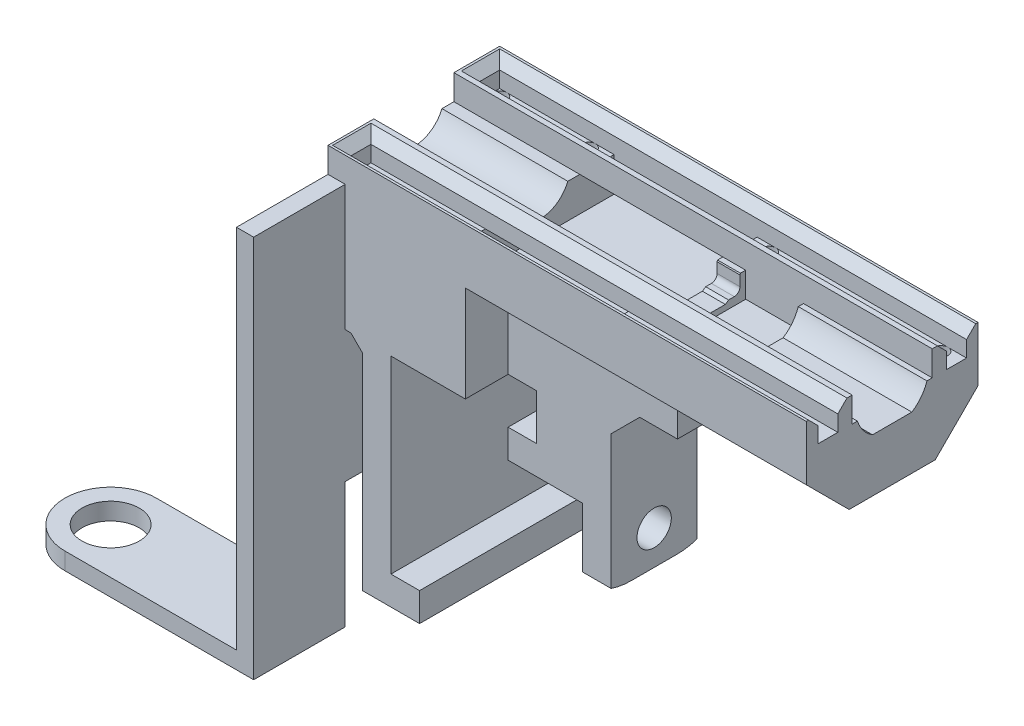
from build123d import *

# Parameters (mm, degrees)
BOSS_EXTRUDE1_DEPTH  = 30
BOSS_EXTRUDE2_DEPTH  = 5
BOSS_EXTRUDE3_START  = -20
BOSS_EXTRUDE3_DEPTH  = 5
BOSS_EXTRUDE4_START  = -8
BOSS_EXTRUDE4_DEPTH  = 5
BOSS_EXTRUDE6_DEPTH  = 16
BOSS_EXTRUDE5_START  = -30
BOSS_EXTRUDE5_DEPTH  = 5
SKETCH11_R           = 3
CUT_EXTRUDE4_DEPTH   = 5
SKETCH12_R           = 1.25
CUT_EXTRUDE5_DEPTH   = 12
SKETCH3_R            = 5.3
CUT_EXTRUDE2_DEPTH   = 22
SKETCH8_R            = 5
CUT_EXTRUDE3_DEPTH   = 3
BOSS_EXTRUDE7_DEPTH  = 13.1
BOSS_EXTRUDE8_START  = 13.1
BOSS_EXTRUDE8_DEPTH  = 23.5
CUT_EXTRUDE6_DEPTH   = 30
SKETCH15_R           = 1.25
CUT_EXTRUDE7_DEPTH   = 30
SKETCH16_W           = 10.1
SKETCH16_H           = 14
CUT_EXTRUDE8_DEPTH   = 4.4
BOSS_EXTRUDE9_START  = -83.6
SKETCH17_W           = 2.5
SKETCH17_H           = 4.4
BOSS_EXTRUDE9_DEPTH  = 83.6
BOSS_EXTRUDE10_START = -53.6
SKETCH18_W           = 2
SKETCH18_H           = 10.4
BOSS_EXTRUDE10_DEPTH = 53.6
SKETCH19_W           = 2
SKETCH19_H           = 4.4
BOSS_EXTRUDE11_DEPTH = 30
BOSS_EXTRUDE12_REACH = 88.105
SKETCH20_W           = 2
SKETCH20_H           = 4.4
BOSS_EXTRUDE13_START = -30
SKETCH20_2_W         = 2
SKETCH20_2_H         = 4.4
BOSS_EXTRUDE13_DEPTH = 5.5
CHAMFER1_SIZE        = 1.6
CUT_EXTRUDE9_REACH   = 113.944


# Read off the part's stored shape, not the designer's step: Boss-Extrude8
with BuildPart() as part:
    # Sketch1 → Boss-Extrude1 (new body)
    with BuildSketch(Plane.XY):
        Polygon((-13, -38), (-23, -38), (-23, -2), (-25, 0), (-26, 0), (-26, -23), (-29, -23), (-29, 22), (-7, 22), (-7, 16), (18, 16), (18, 5), (13, 0), (13, -45), (8, -45), (8, -13), (-5, -13), (-5, -8), (0, -8), (0, 0), (-18, 0), (-18, -33), (-13, -33), align=None)
    extrude(amount=BOSS_EXTRUDE1_DEPTH)

    # Sketch5 → Boss-Extrude2 (add)
    with BuildSketch(Plane.XZ.offset(23)):
        Polygon((-29, 0), (-33.2, 0), (-33.2, 1.7), (-32, 1.7), (-32, 1.2), (-29, 1.2), align=None)
        Polygon((-29, 14.280071998), (-29, 13.080071998), (-33.2, 13.080071998), (-33.2, 14.780071998), (-32, 14.780071998), (-32, 14.280071998), align=None)
        Polygon((-29, 27.360143997), (-29, 26.160143997), (-33.2, 26.160143997), (-33.2, 27.860143997), (-32, 27.860143997), (-32, 27.360143997), align=None)
    extrude(amount=-BOSS_EXTRUDE2_DEPTH)

    # Sketch5<2> → Boss-Extrude3 (add)
    with BuildSketch(Plane.XZ.offset(23).offset(BOSS_EXTRUDE3_START)):
        Polygon((-29, 0), (-33.2, 0), (-33.2, 1.7), (-32, 1.7), (-32, 1.2), (-29, 1.2), align=None)
        Polygon((-29, 14.280071998), (-29, 13.080071998), (-33.2, 13.080071998), (-33.2, 14.780071998), (-32, 14.780071998), (-32, 14.280071998), align=None)
        Polygon((-29, 27.360143997), (-29, 26.160143997), (-33.2, 26.160143997), (-33.2, 27.860143997), (-32, 27.860143997), (-32, 27.360143997), align=None)
    extrude(amount=BOSS_EXTRUDE3_DEPTH)

    # Sketch6 → Boss-Extrude4 (add)
    with BuildSketch(Plane.XZ.offset(23).offset(BOSS_EXTRUDE4_START)):
        Polygon((-29, 3.2), (-29, 4.4), (-33.2, 4.4), (-33.2, 2.7), (-32, 2.7), (-32, 3.2), align=None)
        Polygon((-32, 15.997955345), (-29, 15.997955345), (-29, 17.197955345), (-33.2, 17.197955345), (-33.2, 15.497955345), (-32, 15.497955345), align=None)
        Polygon((-32, 28.795910691), (-29, 28.795910691), (-29, 29.995910691), (-33.2, 29.995910691), (-33.2, 28.295910691), (-32, 28.295910691), align=None)
    extrude(amount=-BOSS_EXTRUDE4_DEPTH)

    # Sketch7 → Boss-Extrude6 (add)
    with BuildSketch(Plane.XY.offset(30)):
        Polygon((-67, -42), (-29, -42), (-29, 22), (-26, 22), (-26, -45), (-67, -45), align=None)
    extrude(amount=BOSS_EXTRUDE6_DEPTH)

    # Sketch6<2> → Boss-Extrude5 (add)
    with BuildSketch(Plane.XZ.offset(23).offset(BOSS_EXTRUDE5_START)):
        Polygon((-29, 3.2), (-29, 4.4), (-33.2, 4.4), (-33.2, 2.7), (-32, 2.7), (-32, 3.2), align=None)
        Polygon((-32, 15.997955345), (-29, 15.997955345), (-29, 17.197955345), (-33.2, 17.197955345), (-33.2, 15.497955345), (-32, 15.497955345), align=None)
        Polygon((-32, 28.795910691), (-29, 28.795910691), (-29, 29.995910691), (-33.2, 29.995910691), (-33.2, 28.295910691), (-32, 28.295910691), align=None)
    extrude(amount=BOSS_EXTRUDE5_DEPTH)

    # Sketch11 → Cut-Extrude4 (cut)
    with BuildSketch(Plane.ZY.offset(-8)):
        with Locations((15, -18)):
            Circle(SKETCH11_R)
        with BuildLine():
            ThreePointArc((11, -24), (3.221825407, -20.778174593), (0, -13))
            Line((0, -13), (0, -45))
            Line((0, -45), (30, -45))
            Line((30, -45), (30, -13))
            ThreePointArc((30, -13), (26.778174593, -20.778174593), (19, -24))
            Line((19, -24), (11, -24))
        make_face()
    extrude(amount=-CUT_EXTRUDE4_DEPTH, mode=Mode.SUBTRACT)

    # Sketch12 → Cut-Extrude5 (cut)
    with BuildSketch(Plane(origin=(0, 22, 0), x_dir=(1, 0, 0), z_dir=(0, 1, 0))):
        with Locations(Location((-10.25, -3.25, 0), (0, 0, 270))):
            Circle(SKETCH12_R)
        with Locations(Location((-10.25, -26.75, 0), (0, 0, 270))):
            Circle(SKETCH12_R)
        with Locations(Location((-25.75, -3.25, 0), (0, 0, 270))):
            Circle(SKETCH12_R)
        with Locations(Location((-25.75, -26.75, 0), (0, 0, 270))):
            Circle(SKETCH12_R)
    extrude(amount=-CUT_EXTRUDE5_DEPTH, mode=Mode.SUBTRACT)

    # Sketch3 → Cut-Extrude2 (cut)
    with BuildSketch(Plane(origin=(-7, 0, 0), x_dir=(0, 0, -1), z_dir=(1, 0, 0))):
        with Locations((-15, 24)):
            Circle(SKETCH3_R)
    extrude(amount=-CUT_EXTRUDE2_DEPTH, mode=Mode.SUBTRACT)

    # Sketch8 → Cut-Extrude3 (cut)
    with BuildSketch(Plane(origin=(0, -42, 0), x_dir=(1, 0, 0), z_dir=(0, 1, 0))):
        with BuildLine():
            ThreePointArc((-59, -46), (-64.656854249, -43.656854249), (-67, -38))
            Line((-67, -38), (-67, -46))
            Line((-67, -46), (-59, -46))
        make_face()
        with Locations(Location((-59, -38, 0), (0, 0, 180))):
            Circle(SKETCH8_R)
        with BuildLine():
            ThreePointArc((-67, -38), (-64.656854249, -32.343145751), (-59, -30))
            Line((-59, -30), (-67, -30))
            Line((-67, -30), (-67, -38))
        make_face()
    extrude(amount=-CUT_EXTRUDE3_DEPTH, mode=Mode.SUBTRACT)

    # Sketch13 → Boss-Extrude7 (add)
    with BuildSketch(Plane(origin=(18, 0, 0), x_dir=(0, 0, -1), z_dir=(1, 0, 0))):
        with BuildLine():
            Line((0, 22), (-8.920526339, 22))
            ThreePointArc((-8.920526339, 22), (-8.959195812, 21.886073615), (-9, 21.772894255))
            Line((-9, 21.772894255), (-9, 20))
            ThreePointArc((-9, 20), (-9.292893219, 19.292893219), (-10, 19))
            Line((-10, 19), (-11.005003129, 19))
            ThreePointArc((-11.005003129, 19), (-11.279565555, 18.792470111), (-11.564887193, 18.6))
            Line((-11.564887193, 18.6), (-18.435112807, 18.6))
            ThreePointArc((-18.435112807, 18.6), (-18.720434445, 18.792470111), (-18.994996871, 19))
            Line((-18.994996871, 19), (-20, 19))
            ThreePointArc((-20, 19), (-20.707106781, 19.292893219), (-21, 20))
            Line((-21, 20), (-21, 21.772894255))
            ThreePointArc((-21, 21.772894255), (-21.040804188, 21.886073615), (-21.079473661, 22))
            Line((-21.079473661, 22), (-30, 22))
            Line((-30, 22), (-30, 5))
            Line((-30, 5), (0, 5))
            Line((0, 5), (0, 22))
        make_face()
    extrude(amount=BOSS_EXTRUDE7_DEPTH)

    # Boss-Extrude8 outline → Boss-Extrude8 (add)
    with BuildSketch(Plane(origin=(18, 0, 0), x_dir=(0, 0, -1), z_dir=(1, 0, 0)).offset(BOSS_EXTRUDE8_START)):
        with BuildLine():
            ThreePointArc((-18.435112807, 18.6), (-20.051914382, 20.070857462), (-21.079473661, 22))
            Line((-21.079473661, 22), (-30, 22))
            Line((-30, 22), (-30, 5))
            Line((-30, 5), (0, 5))
            Line((0, 5), (0, 22))
            Line((0, 22), (-8.920526339, 22))
            ThreePointArc((-8.920526339, 22), (-9.948085618, 20.070857462), (-11.564887193, 18.6))
            Line((-11.564887193, 18.6), (-18.435112807, 18.6))
        make_face()
    extrude(amount=BOSS_EXTRUDE8_DEPTH)

    # Sketch14 → Cut-Extrude6 (cut)
    with BuildSketch(Plane(origin=(54.6, 0, 0), x_dir=(0, 0, -1), z_dir=(1, 0, 0))):
        Polygon((-30, 16.80810234), (-22.523053735, 9.331156075), (-7.476946265, 9.331156075), (0, 16.80810234), (0, 0), (-30, 0), align=None)
    extrude(amount=-CUT_EXTRUDE6_DEPTH, mode=Mode.SUBTRACT)

    # Sketch15 → Cut-Extrude7 (cut)
    with BuildSketch(Plane(origin=(0, 22, 0), x_dir=(1, 0, 0), z_dir=(0, 1, 0))):
        with Locations(Location((51.35, -26.75, 0), (0, 0, 180))):
            Circle(SKETCH15_R)
        with Locations(Location((21.25, -26.75, 0), (0, 0, 180))):
            Circle(SKETCH15_R)
        with Locations(Location((51.35, -3.25, 0), (0, 0, 180))):
            Circle(SKETCH15_R)
        with Locations(Location((21.25, -3.25, 0), (0, 0, 180))):
            Circle(SKETCH15_R)
    extrude(amount=-CUT_EXTRUDE7_DEPTH, mode=Mode.SUBTRACT)

    # Sketch16 → Cut-Extrude8 (cut)
    with BuildSketch(Plane(origin=(0, 22, 0), x_dir=(1, 0, 0), z_dir=(0, 1, 0))):
        with Locations((27.05, -15)):
            Rectangle(SKETCH16_W, SKETCH16_H)
    extrude(amount=-CUT_EXTRUDE8_DEPTH, mode=Mode.SUBTRACT)

    # Sketch17 → Boss-Extrude9 (add)
    with BuildSketch(Plane(origin=(54.6, 0, 0), x_dir=(0, 0, -1), z_dir=(1, 0, 0)).offset(BOSS_EXTRUDE9_START)):
        with Locations((-23.25, 24.2)):
            Rectangle(SKETCH17_W, SKETCH17_H)
        with Locations((-6.75, 24.2)):
            Rectangle(SKETCH17_W, SKETCH17_H)
    extrude(amount=BOSS_EXTRUDE9_DEPTH)

    # Sketch18 → Boss-Extrude10 (add)
    with BuildSketch(Plane(origin=(24.6, 0, 0), x_dir=(0, 0, -1), z_dir=(1, 0, 0)).offset(BOSS_EXTRUDE10_START)):
        with Locations((-29, 21.2)):
            Rectangle(SKETCH18_W, SKETCH18_H)
        with Locations((-1, 21.2)):
            Rectangle(SKETCH18_W, SKETCH18_H)
    extrude(amount=BOSS_EXTRUDE10_DEPTH)

    # Sketch19 → Boss-Extrude11 (add)
    with BuildSketch(Plane(origin=(24.6, 0, 0), x_dir=(0, 0, -1), z_dir=(1, 0, 0))):
        with Locations((-1, 24.2)):
            Rectangle(SKETCH19_W, SKETCH19_H)
        with Locations((-29, 24.2)):
            Rectangle(SKETCH19_W, SKETCH19_H)
    extrude(amount=BOSS_EXTRUDE11_DEPTH)

    # Boss-Extrude12: up to this face of the body (flat: up to its plane)
    boss_extrude12_end = Plane(part.part.faces().sort_by_distance((12.8, 24.2, 24.5))[0])
    # Sketch20 → Boss-Extrude12 (add, up to the picked face)
    with BuildSketch(Plane.XY.offset(30), mode=Mode.PRIVATE) as boss_extrude12_sk1:
        with Locations((-28, 24.2)):
            Rectangle(SKETCH20_W, SKETCH20_H)
    boss_extrude12_tool1 = split(extrude(boss_extrude12_sk1.sketch, amount=-BOSS_EXTRUDE12_REACH, mode=Mode.PRIVATE), bisect_by=boss_extrude12_end, keep=Keep.BOTH, mode=Mode.PRIVATE)
    add(boss_extrude12_tool1.solids().sort_by(Axis((-28, 24.2, 30), (0, 0, -1)))[0])

    # Sketch20<2> → Boss-Extrude13 (add)
    with BuildSketch(Plane.XY.offset(30).offset(BOSS_EXTRUDE13_START)):
        with Locations((-28, 24.2)):
            Rectangle(SKETCH20_2_W, SKETCH20_2_H)
    extrude(amount=BOSS_EXTRUDE13_DEPTH)

    # Chamfer1
    chamfer1_edges = [part.edges().sort_by_distance(p)[0] for p in [
        (13.8, 26.4, 28),
        (13.8, 26.4, 24.5),
        (-27, 26.4, 26.25),
        (13.8, 26.4, 2),
        (13.8, 26.4, 5.5),
        (-27, 26.4, 3.75),
    ]]
    chamfer(chamfer1_edges, length=CHAMFER1_SIZE)

    # Cut-Extrude9: up to this face of the body (flat: up to its plane)
    cut_extrude9_end = Plane(part.part.faces().sort_by_distance((-5, -10.5, 15))[0])
    # Sketch21 → Cut-Extrude9 (cut, up to the picked face)
    with BuildSketch(Plane(origin=(24.6, 0, 0), x_dir=(0, 0, -1), z_dir=(1, 0, 0)), mode=Mode.PRIVATE) as cut_extrude9_sk1:
        Polygon((-30, 16.80810234), (-22.523053735, 9.331156075), (-22.523053735, -24), (-30, -24), align=None)
    cut_extrude9_tool1 = split(extrude(cut_extrude9_sk1.sketch, amount=-CUT_EXTRUDE9_REACH, mode=Mode.PRIVATE), bisect_by=cut_extrude9_end, keep=Keep.BOTH, mode=Mode.PRIVATE)
    # Sketch21 → Cut-Extrude9 (cut, up to the picked face)
    with BuildSketch(Plane(origin=(24.6, 0, 0), x_dir=(0, 0, -1), z_dir=(1, 0, 0)), mode=Mode.PRIVATE) as cut_extrude9_sk2:
        Polygon((0, 16.80810234), (-7.476946265, 9.331156075), (-7.476946265, -24), (0, -24), align=None)
    cut_extrude9_tool2 = split(extrude(cut_extrude9_sk2.sketch, amount=-CUT_EXTRUDE9_REACH, mode=Mode.PRIVATE), bisect_by=cut_extrude9_end, keep=Keep.BOTH, mode=Mode.PRIVATE)
    add(cut_extrude9_tool1.solids().sort_by(Axis((24.6, -5.402348, 26.387202), (-1, 0, 0)))[0], mode=Mode.SUBTRACT)
    add(cut_extrude9_tool2.solids().sort_by(Axis((24.6, -5.402348, 3.612798), (-1, 0, 0)))[0], mode=Mode.SUBTRACT)


solid = part.part
